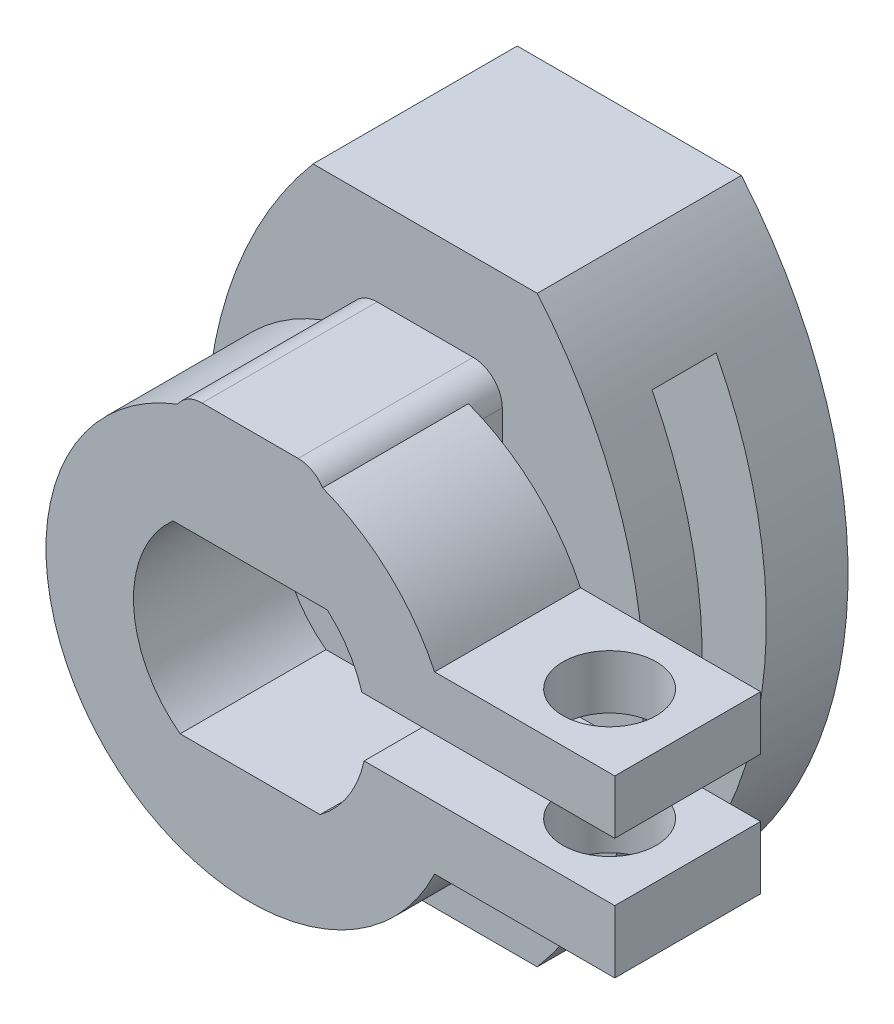
from build123d import *

# Parameters (mm, degrees)
SKETCH_1_W               = 16
SKETCH_1_H               = 20
EXTRUDE_1_DEPTH          = 7
CUT_EXTRUDE_1_DEPTH      = 15
CUT_EXTRUDE_3_DEPTH      = 15.594519519
SKETCH_6_W               = 5.291502622
SKETCH_6_H               = 4
EXTRUDE_2_DEPTH          = 1
CUT_EXTRUDE_5_DEPTH      = 17.338184405
CUT_EXTRUDE_5_DEPTH_BACK = 17.338184405
SKETCH_7_W               = 2.2
SKETCH_7_H               = 14.2
SKETCH_8_R               = 4.915012662
EXTRUDE_3_DEPTH          = 1.5
SKETCH_9_R               = 7
SKETCH_9_R_2             = 4
EXTRUDE_4_DEPTH          = 5
SKETCH_10_W              = 5.291502622
SKETCH_10_H              = 4
SKETCH_10_W_2            = 5.341465502
SKETCH_10_H_2            = 1.894443453
EXTRUDE_5_DEPTH          = 5
FILLET_1_R               = 1
EXTRUDE_6_DEPTH          = 5
CUT_EXTRUDE_6_DEPTH      = 21.622580814
CUT_EXTRUDE_6_DEPTH_BACK = 5
SKETCH_12_W              = 10.898323227
SKETCH_12_H              = 2
SKETCH_13_R              = 1.6
CUT_EXTRUDE_7_DEPTH      = 23.232652551


with BuildPart() as part:
    # 草图1 → 凸台-拉伸1 (new body)
    with BuildSketch(Plane.XY):
        Rectangle(SKETCH_1_W, SKETCH_1_H)
    extrude(amount=EXTRUDE_1_DEPTH)

    # 草图2 → 切除-拉伸1 (cut)
    with BuildSketch(Plane.XY.offset(7)):
        with BuildLine():
            Line((-2.645751311, 3), (2.645751311, 3))
            ThreePointArc((2.645751311, 3), (4.091798312, -0.088548302), (2.695714191, -3.2))
            Line((2.695714191, -3.2), (-2.695714191, -3.2))
            ThreePointArc((-2.695714191, -3.2), (-4.091798312, -0.088548302), (-2.645751311, 3))
        make_face()
    extrude(amount=-CUT_EXTRUDE_1_DEPTH, mode=Mode.SUBTRACT)

    # 草图4 → 切除-拉伸3 (cut, through all)
    with BuildSketch(Plane.XY.offset(7)):
        with BuildLine():
            Line((-3.842719282, 10), (-8, 10))
            Line((-8, 10), (-8, -10))
            Line((-8, -10), (-3.842719282, -10))
            ThreePointArc((-3.842719282, -10), (-7.5, 0), (-3.842719282, 10))
        make_face()
        with BuildLine():
            Line((3.842719282, 10), (8, 10))
            Line((8, 10), (8, -10))
            Line((8, -10), (3.842719282, -10))
            ThreePointArc((3.842719282, -10), (7.5, 0), (3.842719282, 10))
        make_face()
    extrude(amount=-CUT_EXTRUDE_3_DEPTH, mode=Mode.SUBTRACT)

    # 草图6 → 凸台-拉伸2 (add)
    with BuildSketch(Plane.XY.offset(7)):
        with Locations((0, 5)):
            Rectangle(SKETCH_6_W, SKETCH_6_H)
    extrude(amount=EXTRUDE_2_DEPTH)

    # 草图7 → 切除-拉伸5 (cut, two sides: drawn at the far end of the back side and taken through both)
    with BuildSketch(Plane.ZY.offset(2.645751311).offset(-CUT_EXTRUDE_5_DEPTH_BACK)):
        with Locations((3.9, 0)):
            Rectangle(SKETCH_7_W, SKETCH_7_H)
    extrude(amount=CUT_EXTRUDE_5_DEPTH + CUT_EXTRUDE_5_DEPTH_BACK, mode=Mode.SUBTRACT)

    # 草图8 → 凸台-拉伸3 (add)
    with BuildSketch(Plane(origin=(0, 0, 0), x_dir=(-1, 0, 0), z_dir=(0, 0, -1))):
        Circle(SKETCH_8_R)
    extrude(amount=-EXTRUDE_3_DEPTH)

    # 草图9 → 凸台-拉伸4 (add)
    with BuildSketch(Plane.XY.offset(8)):
        with Locations(Location((0, 0, 0), (0, 0, 112.207654299))):
            Circle(SKETCH_9_R)
        with Locations(Location((0, 0, 0), (0, 0, 131.409622109))):
            Circle(SKETCH_9_R_2, mode=Mode.SUBTRACT)
    extrude(amount=EXTRUDE_4_DEPTH)

    # 草图10 → 凸台-拉伸5 (add)
    with BuildSketch(Plane.XY.offset(8)):
        with Locations((0, 5)):
            Rectangle(SKETCH_10_W, SKETCH_10_H)
        with Locations((0.02498144, -4.147221726)):
            Rectangle(SKETCH_10_W_2, SKETCH_10_H_2)
    extrude(amount=EXTRUDE_5_DEPTH)

    # 圆角1
    # the kernel refuses this fillet: 1 mm, written as the material it takes off along each edge
    with BuildSketch(Plane(origin=(2.645751311, 7, 7), x_dir=(-1, 0, 0), z_dir=(0, 0, 1))) as fillet_1_piece_1_section:
        with BuildLine():
            CenterArc((FILLET_1_R, FILLET_1_R), FILLET_1_R, 180, 90)
            Line((0, FILLET_1_R), (0, 0))
            Line((0, 0), (FILLET_1_R, 0))
        make_face()
    fillet_1_piece_1 = extrude(amount=8.5, mode=Mode.PRIVATE)
    fillet_1_piece_1 = split(fillet_1_piece_1, bisect_by=Plane(origin=(2.390465062, 6.836939251, 8), z_dir=(0, 0, -1)), keep=Keep.TOP, mode=Mode.PRIVATE)
    fillet_1_piece_1 = fillet_1_piece_1 - Plane(origin=(0, 0, 7.5), x_dir=(-0.3779644730157475, 0.9258200997698897, 0), z_dir=(0, 0, -1)) * Cylinder(7, 21, mode=Mode.PRIVATE)
    add(fillet_1_piece_1, mode=Mode.SUBTRACT)
    with BuildSketch(Plane(origin=(2.645751311, 7, 7), x_dir=(-1, 0, 0), z_dir=(0, 0, 1))) as fillet_1_piece_2_section:
        with BuildLine():
            CenterArc((FILLET_1_R, FILLET_1_R), FILLET_1_R, 180, 90)
            Line((0, FILLET_1_R), (0, 0))
            Line((0, 0), (FILLET_1_R, 0))
        make_face()
    fillet_1_piece_2 = extrude(amount=8.5, mode=Mode.PRIVATE)
    fillet_1_piece_2 = split(fillet_1_piece_2, bisect_by=Plane(origin=(2.615865348, 6.342822841, 8), z_dir=(0, 0, -1)), keep=Keep.TOP, mode=Mode.PRIVATE)
    fillet_1_piece_2 = fillet_1_piece_2 & Plane(origin=(0, 0, 7.5), x_dir=(-0.3779644730157475, 0.9258200997698897, 0), z_dir=(0, 0, -1)) * Cylinder(7, 21, mode=Mode.PRIVATE)
    add(fillet_1_piece_2, mode=Mode.SUBTRACT)
    with BuildSketch(Plane(origin=(2.645751311, 7, 7), x_dir=(-1, 0, 0), z_dir=(0, 0, 1))) as fillet_1_piece_3_section:
        with BuildLine():
            CenterArc((FILLET_1_R, FILLET_1_R), FILLET_1_R, 180, 90)
            Line((0, FILLET_1_R), (0, 0))
            Line((0, 0), (FILLET_1_R, 0))
        make_face()
    fillet_1_piece_3 = extrude(amount=8.5, mode=Mode.PRIVATE)
    fillet_1_piece_3 = split(fillet_1_piece_3, bisect_by=Plane(origin=(2.390465062, 6.836939251, 8), z_dir=(0, 0, 1)), keep=Keep.TOP, mode=Mode.PRIVATE)
    fillet_1_piece_3 = fillet_1_piece_3 - Plane(origin=(0, 0, 11.75), x_dir=(-0.3779644730157475, 0.9258200997698897, 0), z_dir=(0, 0, -1)) * Cylinder(7, 21, mode=Mode.PRIVATE)
    add(fillet_1_piece_3, mode=Mode.SUBTRACT)
    with BuildSketch(Plane(origin=(-2.645751311, 7, 7), x_dir=(0, -1, 0), z_dir=(0, 0, 1))) as fillet_1_piece_4_section:
        with BuildLine():
            CenterArc((FILLET_1_R, FILLET_1_R), FILLET_1_R, 180, 90)
            Line((0, FILLET_1_R), (0, 0))
            Line((0, 0), (FILLET_1_R, 0))
        make_face()
    fillet_1_piece_4 = extrude(amount=8.5, mode=Mode.PRIVATE)
    fillet_1_piece_4 = fillet_1_piece_4 & Plane(origin=(0, 0, 7.5), x_dir=(-0.3779644730157475, 0.9258200997698897, 0), z_dir=(0, 0, -1)) * Cylinder(7, 21, mode=Mode.PRIVATE)
    fillet_1_piece_4 = split(fillet_1_piece_4, bisect_by=Plane(origin=(-2.615865348, 6.342822841, 8), z_dir=(0, 0, -1)), keep=Keep.TOP, mode=Mode.PRIVATE)
    add(fillet_1_piece_4, mode=Mode.SUBTRACT)
    with BuildSketch(Plane(origin=(-2.645751311, 7, 7), x_dir=(0, -1, 0), z_dir=(0, 0, 1))) as fillet_1_piece_5_section:
        with BuildLine():
            CenterArc((FILLET_1_R, FILLET_1_R), FILLET_1_R, 180, 90)
            Line((0, FILLET_1_R), (0, 0))
            Line((0, 0), (FILLET_1_R, 0))
        make_face()
    fillet_1_piece_5 = extrude(amount=8.5, mode=Mode.PRIVATE)
    fillet_1_piece_5 = fillet_1_piece_5 - Plane(origin=(0, 0, 7.5), x_dir=(-0.3779644730157475, 0.9258200997698897, 0), z_dir=(0, 0, -1)) * Cylinder(7, 21, mode=Mode.PRIVATE)
    fillet_1_piece_5 = split(fillet_1_piece_5, bisect_by=Plane(origin=(-2.390465062, 6.836939251, 8), z_dir=(0, 0, -1)), keep=Keep.TOP, mode=Mode.PRIVATE)
    add(fillet_1_piece_5, mode=Mode.SUBTRACT)
    with BuildSketch(Plane(origin=(-2.645751311, 7, 7), x_dir=(0, -1, 0), z_dir=(0, 0, 1))) as fillet_1_piece_6_section:
        with BuildLine():
            CenterArc((FILLET_1_R, FILLET_1_R), FILLET_1_R, 180, 90)
            Line((0, FILLET_1_R), (0, 0))
            Line((0, 0), (FILLET_1_R, 0))
        make_face()
    fillet_1_piece_6 = extrude(amount=8.5, mode=Mode.PRIVATE)
    fillet_1_piece_6 = fillet_1_piece_6 - Plane(origin=(0, 0, 11.75), x_dir=(-0.3779644730157475, 0.9258200997698897, 0), z_dir=(0, 0, -1)) * Cylinder(7, 21, mode=Mode.PRIVATE)
    fillet_1_piece_6 = split(fillet_1_piece_6, bisect_by=Plane(origin=(-2.390465062, 6.836939251, 8), z_dir=(0, 0, 1)), keep=Keep.TOP, mode=Mode.PRIVATE)
    add(fillet_1_piece_6, mode=Mode.SUBTRACT)

    # 草图11 → 凸台-拉伸6 (add)
    with BuildSketch(Plane.XY.offset(13)):
        Polygon((12.501633471, 1), (12.501633471, -1), (12.501633471, -3), (5.400773292, -3), (5.400773292, -1), (5.400773292, 1), (5.400773292, 3), (12.501633471, 3), align=None)
    extrude(amount=-EXTRUDE_6_DEPTH)

    # 草图12 → 切除-拉伸6 (cut, two sides: drawn at the far end of the back side and taken through both)
    with BuildSketch(Plane.XY.offset(13).offset(-CUT_EXTRUDE_6_DEPTH_BACK)):
        with Locations((7.052471858, 0.148280364)):
            Rectangle(SKETCH_12_W, SKETCH_12_H)
    extrude(amount=CUT_EXTRUDE_6_DEPTH + CUT_EXTRUDE_6_DEPTH_BACK, mode=Mode.SUBTRACT)

    # 草图13 → 切除-拉伸7 (cut, through all)
    with BuildSketch(Plane(origin=(0, 3, 0), x_dir=(1, 0, 0), z_dir=(0, 1, 0))):
        with Locations(Location((9.82455532, -10.5, 0), (0, 0, 270))):
            Circle(SKETCH_13_R)
    extrude(amount=-CUT_EXTRUDE_7_DEPTH, mode=Mode.SUBTRACT)


solid = part.part
